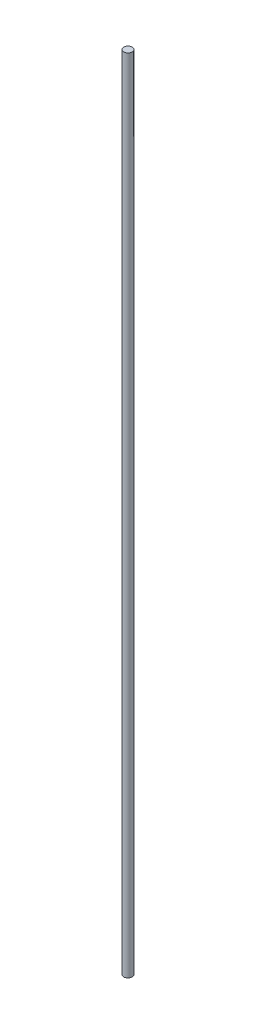
from build123d import *

# Parameters (mm, degrees)
SKETCH1_R           = 3.1
BOSS_EXTRUDE1_DEPTH = 580


with BuildPart() as part:
    # Sketch1 → Boss-Extrude1 (new body)
    with BuildSketch(Plane(origin=(0, 0, 0), x_dir=(1, 0, 0), z_dir=(0, 1, 0))):
        Circle(SKETCH1_R)
    extrude(amount=BOSS_EXTRUDE1_DEPTH)


solid = part.part
